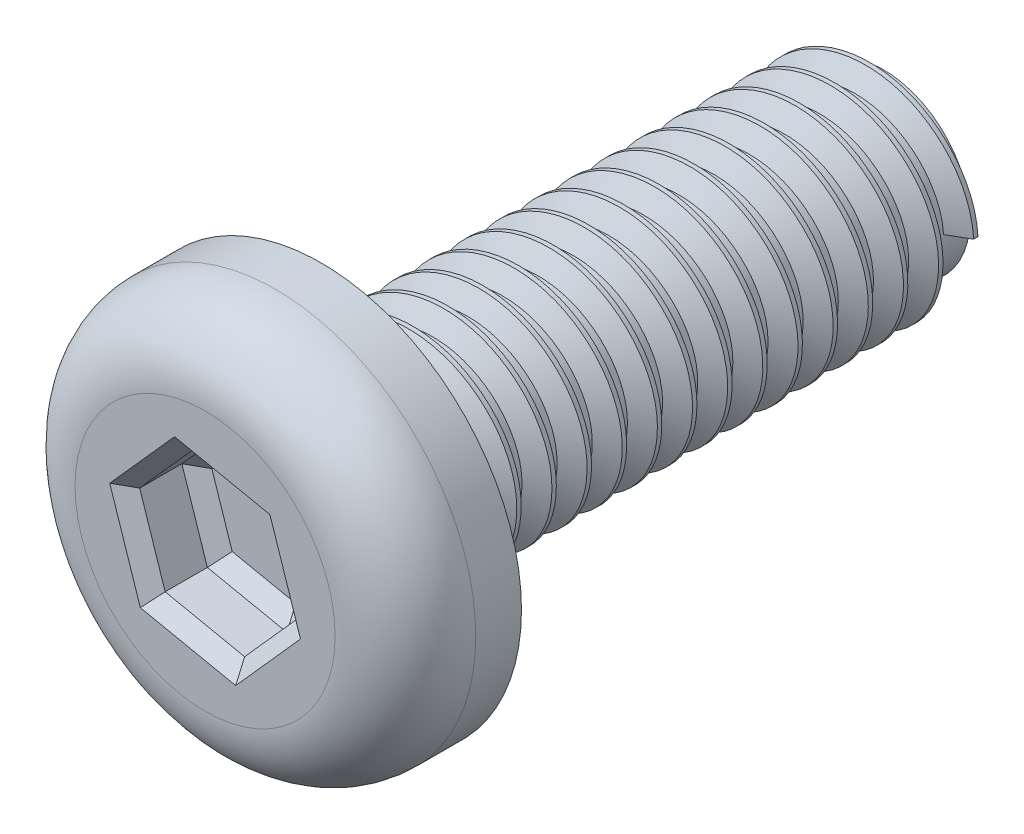
from build123d import *

# Parameters (mm, degrees)
SKETCH_1_R          = 2.85
EXTRUDE_1_DEPTH     = 1.65
SKETCH_2_R          = 1.2295
EXTRUDE_2_DEPTH     = 8
FILLET_1_R          = 1
CUT_EXTRUDE_1_DEPTH = 1
CHAMFER_1_SIZE      = 0.2
THREAD_1_PITCH      = 0.5


with BuildPart() as part:
    # 草图1 → 凸台-拉伸1 (new body)
    with BuildSketch(Plane.XY):
        Circle(SKETCH_1_R)
    extrude(amount=EXTRUDE_1_DEPTH)

    # Sketch 2 → 凸台-拉伸2 (add)
    with BuildSketch(Plane(origin=(0, 0, 0), x_dir=(-1, 0, 0), z_dir=(0, 0, -1))):
        Circle(SKETCH_2_R)
    extrude(amount=EXTRUDE_2_DEPTH)

    # 圆角1
    fillet_1_edges = [part.edges().sort_by_distance(p)[0] for p in [
        (-2.85, 0, 1.65),
    ]]
    fillet(fillet_1_edges, radius=FILLET_1_R)

    # 草图3 → 切除-拉伸1 (cut)
    with BuildSketch(Plane.XY.offset(1.65)):
        Polygon((0.362222341, -1.09641612), (1.130635384, -0.234514311), (0.768413043, 0.861901809), (-0.362222341, 1.09641612), (-1.130635384, 0.234514311), (-0.768413043, -0.861901809), align=None)
    extrude(amount=-CUT_EXTRUDE_1_DEPTH, mode=Mode.SUBTRACT)

    # 倒角1
    chamfer_1_edges = [part.edges().sort_by_distance(p)[0] for p in [
        (-0.203095351, -0.979158965, 0.65),
        (-0.949524213, -0.313693749, 0.65),
        (-0.746428862, 0.665465216, 0.65),
        (0.203095351, 0.979158965, 0.65),
        (0.949524213, 0.313693749, 0.65),
        (0.746428862, -0.665465216, 0.65),
        (-0.203095351, -0.979158965, 1.65),
        (0.746428862, -0.665465216, 1.65),
        (0.949524213, 0.313693749, 1.65),
        (0.203095351, 0.979158965, 1.65),
        (-0.746428862, 0.665465216, 1.65),
        (-0.949524213, -0.313693749, 1.65),
    ]]
    chamfer(chamfer_1_edges, length=CHAMFER_1_SIZE)

    # 螺纹线1: the profile of Sketch 2 2 profile screwed along a right-hand helix of 16 turns, 6 arcs to a turn; built about Z, then put on its axis
    thread_1_z = Axis((0, 0, 0), (0, 0, 1))
    thread_1_corners = [(1.2292, 0, -0.000173205), (1.500132938, 0, 0.156249999), (1.500132938, 0, 0.218749999), (1.2292, 0, 0.375173204)]
    with BuildLine(mode=Mode.PRIVATE) as thread_1_profile:
        Line(thread_1_corners[0], thread_1_corners[1])
        Line(thread_1_corners[1], thread_1_corners[2])
        Line(thread_1_corners[2], thread_1_corners[3])
        Line(thread_1_corners[3], thread_1_corners[0])
    thread_1_cap = Face(thread_1_profile.wire())
    thread_1_turn_angles = [0, 30, 60, 90, 120, 150, 180, 210, 240, 270, 300, 330, 360]
    thread_1_turn_weights = [1, 0.8660254037844387, 1, 0.8660254037844387, 1, 0.8660254037844387, 1, 0.8660254037844387, 1, 0.8660254037844387, 1, 0.8660254037844387, 1]
    thread_1_turn_rails = [Edge.make_bspline([Vector(p[0], p[1], 0).rotate(thread_1_z, thread_1_turn_angles[k]) / thread_1_turn_weights[k] + Vector(0, 0, p[2] + THREAD_1_PITCH * thread_1_turn_angles[k] / 360) for k in range(13)], [0, 0, 0, 1, 1, 2, 2, 3, 3, 4, 4, 5, 5, 6, 6, 6], 2, thread_1_turn_weights) for p in thread_1_corners]
    thread_1_turn_sides = [Face.make_surface_from_curves(thread_1_turn_rails[p[0]], thread_1_turn_rails[p[1]]) for p in [(0, 1), (1, 2), (2, 3), (3, 0)]]
    thread_1 = Plane(origin=(0, 0, -8), x_dir=(1, 0, 0), z_dir=(0, 0, 1)) * Solid(Shell([*[p.moved(Location((0, 0, THREAD_1_PITCH * i))) for i in range(16) for p in thread_1_turn_sides], thread_1_cap, thread_1_cap.rotate(thread_1_z, 5760).moved(Location((0, 0, THREAD_1_PITCH * 5760 / 360)))]))
    add(thread_1)


solid = part.part
